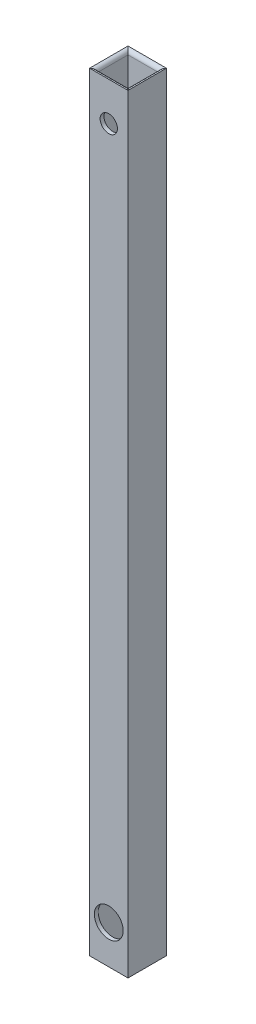
from build123d import *

# Parameters (mm, degrees)
SKETCH1_W           = 10
SKETCH1_H           = 10
SKETCH1_W_2         = 8
SKETCH1_H_2         = 8
BOSS_EXTRUDE1_DEPTH = 200
FILLET2_R           = 1
SKETCH2_R           = 3.75
SKETCH2_R_2         = 2.25
CUT_EXTRUDE1_DEPTH  = 201.31225624


with BuildPart() as part:
    # Sketch1 → Boss-Extrude1 (new body)
    with BuildSketch(Plane(origin=(0, 0, 0), x_dir=(1, 0, 0), z_dir=(0, 1, 0))):
        Rectangle(SKETCH1_W, SKETCH1_H)
        Rectangle(SKETCH1_W_2, SKETCH1_H_2, mode=Mode.SUBTRACT)
    extrude(amount=BOSS_EXTRUDE1_DEPTH)

    # Fillet2
    fillet2_edges = [part.edges().sort_by_distance(p)[0] for p in [
        (4, 0, 0),
        (0, 0, -4),
        (-4, 0, 0),
        (0, 0, 4),
        (4, 200, 0),
        (0, 200, -4),
        (-4, 200, 0),
        (0, 200, 4),
    ]]
    fillet(fillet2_edges, radius=FILLET2_R - 0.0001)  # a hair under: the kernel refuses the full size

    # Sketch2 → Cut-Extrude1 (cut, through all)
    with BuildSketch(Plane.XY.offset(5)):
        with Locations((0, 10)):
            Circle(SKETCH2_R)
        with Locations((0, 190)):
            Circle(SKETCH2_R_2)
    extrude(amount=-CUT_EXTRUDE1_DEPTH, mode=Mode.SUBTRACT)


solid = part.part
